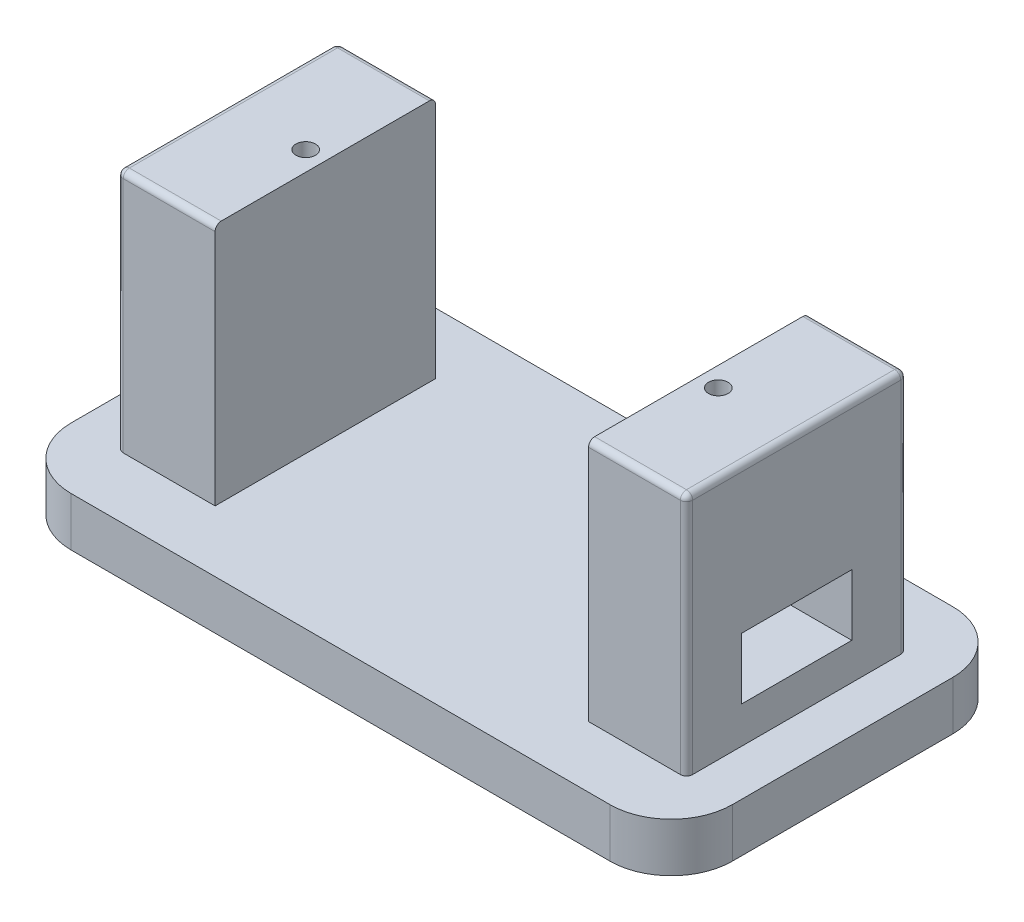
from build123d import *

# Parameters (mm, degrees)
SKETCH1_W           = 54
SKETCH1_H           = 28
BOSS_EXTRUDE1_DEPTH = 4
SKETCH4_W           = 8
SKETCH4_H           = 18
BOSS_EXTRUDE3_DEPTH = 19.9
FILLET1_R           = 5
SKETCH5_R           = 0.8
CUT_EXTRUDE1_DEPTH  = 5
SKETCH6_W           = 9
SKETCH6_H           = 5
CUT_EXTRUDE2_DEPTH  = 13
FILLET4_R           = 0.5
FILLET5_R           = 0.5


with BuildPart() as part:
    # Sketch1 → Boss-Extrude1 (new body)
    with BuildSketch(Plane(origin=(0, 0, 0), x_dir=(1, 0, 0), z_dir=(0, 1, 0))):
        Rectangle(SKETCH1_W, SKETCH1_H)
    extrude(amount=BOSS_EXTRUDE1_DEPTH)

    # Sketch4 → Boss-Extrude3 (add)
    with BuildSketch(Plane(origin=(0, 4, 0), x_dir=(1, 0, 0), z_dir=(0, 1, 0))):
        with Locations((-19.25, 0)):
            Rectangle(SKETCH4_W, SKETCH4_H)
    boss_extrude3 = extrude(amount=BOSS_EXTRUDE3_DEPTH)

    # Mirror2: Boss-Extrude3 across plane
    add(boss_extrude3.mirror(Plane(origin=(0, 0, 0), x_dir=(0, 0, 1), z_dir=(1, 0, 0))))

    # Fillet1
    fillet1_edges = [part.edges().sort_by_distance(p)[0] for p in [
        (27, 2, 14),
        (-27, 2, 14),
        (-27, 2, -14),
        (27, 2, -14),
    ]]
    fillet(fillet1_edges, radius=FILLET1_R)

    # Sketch5 → Cut-Extrude1 (cut)
    with BuildSketch(Plane(origin=(0, 23.9, 0), x_dir=(1, 0, 0), z_dir=(0, 1, 0))):
        with Locations(Location((-16.85, 0, 0), (0, 0, 270))):
            Circle(SKETCH5_R)
    cut_extrude1 = extrude(amount=-CUT_EXTRUDE1_DEPTH, mode=Mode.SUBTRACT)

    # Mirror3: Cut-Extrude1 across plane
    add(cut_extrude1.mirror(Plane(origin=(0, 0, 0), x_dir=(0, 0, 1), z_dir=(1, 0, 0))), mode=Mode.SUBTRACT)

    # Sketch6 → Cut-Extrude2 (cut)
    with BuildSketch(Plane(origin=(23.25, 0, 0), x_dir=(0, 0, -1), z_dir=(1, 0, 0))):
        with Locations((0, 9.492209163)):
            Rectangle(SKETCH6_W, SKETCH6_H)
    extrude(amount=-CUT_EXTRUDE2_DEPTH, mode=Mode.SUBTRACT)

    # Fillet4
    fillet4_edges = [part.edges().sort_by_distance(p)[0] for p in [
        (-19.25, 23.9, -9),
        (-23.25, 23.9, 0),
        (-19.25, 23.9, 9),
        (19.25, 23.9, 9),
        (23.25, 23.9, 0),
        (19.25, 23.9, -9),
    ]]
    fillet(fillet4_edges, radius=FILLET4_R)

    # Fillet5
    # the kernel refuses this fillet: 0.5 mm, written as the material it takes off along each edge
    with BuildSketch(Plane(origin=(-22.75, 23.4, 8.5), x_dir=(-1, 0, 0), z_dir=(0, 0, 1))) as fillet5_piece_1_section:
        Polygon((0, 0), (FILLET5_R, 0), (FILLET5_R, -FILLET5_R), (0, -FILLET5_R), align=None)
    fillet5_piece_1 = extrude(amount=FILLET5_R, mode=Mode.PRIVATE)
    fillet5_piece_1 = fillet5_piece_1 - Plane(origin=(-22.75, 23.4, 8.5), x_dir=(0.7071067811865475, -0.7071067811865475, 0), z_dir=(0, 0, 1)) * Sphere(FILLET5_R, mode=Mode.PRIVATE)
    add(fillet5_piece_1, mode=Mode.SUBTRACT)
    with BuildSketch(Plane(origin=(-22.75, 23.4, -8.5), x_dir=(-1, 0, 0), z_dir=(0, 0, -1))) as fillet5_piece_2_section:
        Polygon((0, 0), (FILLET5_R, 0), (FILLET5_R, FILLET5_R), (0, FILLET5_R), align=None)
    fillet5_piece_2 = extrude(amount=FILLET5_R, mode=Mode.PRIVATE)
    fillet5_piece_2 = fillet5_piece_2 - Plane(origin=(-22.75, 23.4, -8.5), x_dir=(0.7071067811865475, -0.7071067811865475, 0), z_dir=(0, 0, -1)) * Sphere(FILLET5_R, mode=Mode.PRIVATE)
    add(fillet5_piece_2, mode=Mode.SUBTRACT)
    with BuildSketch(Plane(origin=(22.75, 23.4, -8.5), x_dir=(1, 0, 0), z_dir=(0, 0, -1))) as fillet5_piece_3_section:
        Polygon((0, 0), (FILLET5_R, 0), (FILLET5_R, -FILLET5_R), (0, -FILLET5_R), align=None)
    fillet5_piece_3 = extrude(amount=FILLET5_R, mode=Mode.PRIVATE)
    fillet5_piece_3 = fillet5_piece_3 - Plane(origin=(22.75, 23.4, -8.5), x_dir=(-0.7071067811865475, -0.7071067811865475, 0), z_dir=(0, 0, -1)) * Sphere(FILLET5_R, mode=Mode.PRIVATE)
    add(fillet5_piece_3, mode=Mode.SUBTRACT)
    with BuildSketch(Plane(origin=(22.75, 23.4, 8.5), x_dir=(0, 0, 1), z_dir=(1, 0, 0))) as fillet5_piece_4_section:
        Polygon((0, 0), (FILLET5_R, 0), (FILLET5_R, -FILLET5_R), (0, -FILLET5_R), align=None)
    fillet5_piece_4 = extrude(amount=FILLET5_R, mode=Mode.PRIVATE)
    fillet5_piece_4 = fillet5_piece_4 - Plane(origin=(22.75, 23.4, 8.5), x_dir=(0, -0.7071067811865475, -0.7071067811865475), z_dir=(1, 0, 0)) * Sphere(FILLET5_R, mode=Mode.PRIVATE)
    add(fillet5_piece_4, mode=Mode.SUBTRACT)
    with BuildSketch(Plane(origin=(-23.25, 4, -9), x_dir=(1, 0, 0), z_dir=(0, 1, 0))) as fillet5_piece_5:
        with BuildLine():
            CenterArc((FILLET5_R, -FILLET5_R), FILLET5_R, 90, 90)
            Line((0, -FILLET5_R), (0, 0))
            Line((0, 0), (FILLET5_R, 0))
        make_face()
    extrude(amount=19.4, mode=Mode.SUBTRACT)
    with BuildSketch(Plane(origin=(-23.25, 4, 9), x_dir=(1, 0, 0), z_dir=(0, 1, 0)), Plane(origin=(23.25, 4, 9), x_dir=(0, 0, -1), z_dir=(0, 1, 0)), Plane(origin=(23.25, 4, -9), x_dir=(-1, 0, 0), z_dir=(0, 1, 0))) as fillet5_piece_6:
        with BuildLine():
            CenterArc((FILLET5_R, FILLET5_R), FILLET5_R, 180, 90)
            Line((0, FILLET5_R), (0, 0))
            Line((0, 0), (FILLET5_R, 0))
        make_face()
    extrude(amount=19.4, mode=Mode.SUBTRACT)


solid = part.part
